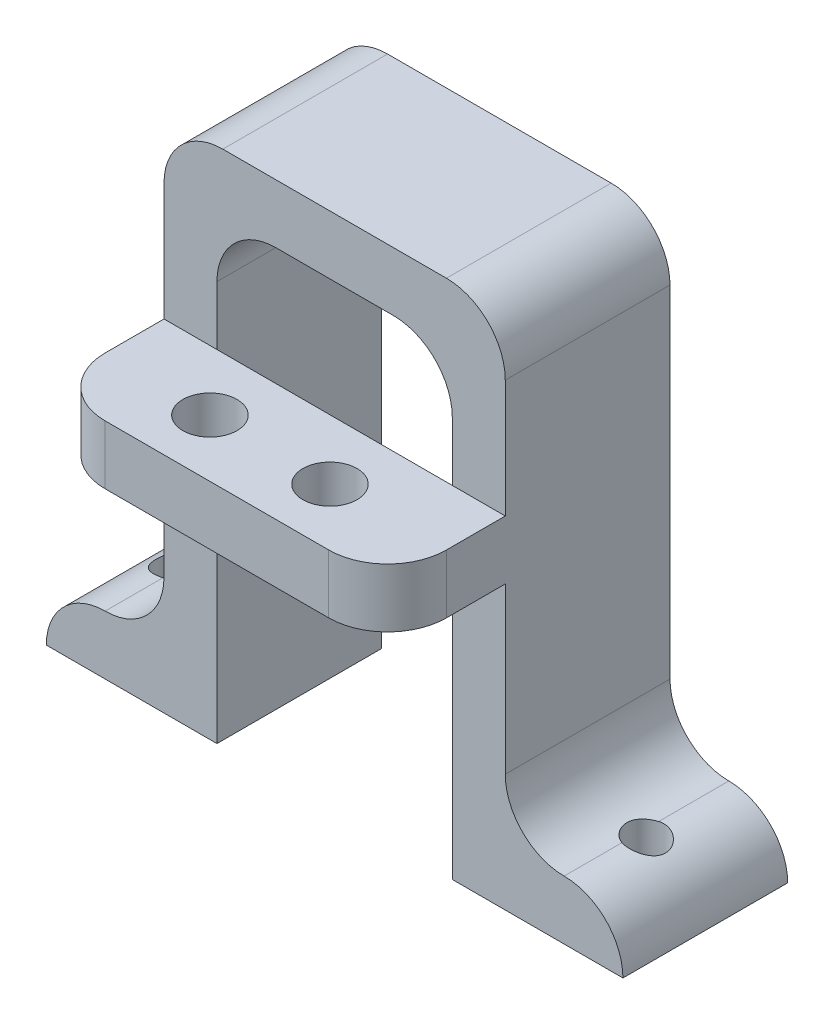
from build123d import *

# Parameters (mm, degrees)
BOSS_EXTRUDE1_DEPTH     = 14
FILLET1_R               = 5
FILLET2_R               = 5
CUT_EXTRUDE3_DEPTH      = 10
CUT_EXTRUDE3_DEPTH_BACK = 10
SKETCH2_R               = 1.636049027
SKETCH4_W               = 29
SKETCH4_H               = 5
BOSS_EXTRUDE2_DEPTH     = 10
SKETCH5_R               = 2.3
CUT_EXTRUDE4_DEPTH      = 30
FILLET3_R               = 5


with BuildPart() as part:
    # Sketch1 → Boss-Extrude1 (new body)
    with BuildSketch(Plane.XY):
        Polygon((-24.5, 0), (-24.5, 5), (-14.5, 5), (-14.5, 44), (14.5, 44), (14.5, 5), (24.5, 5), (24.5, 0), (10, 0), (10, 39), (-10, 39), (-10, 0), align=None)
    extrude(amount=BOSS_EXTRUDE1_DEPTH)

    # Fillet1
    fillet1_edges = [part.edges().sort_by_distance(p)[0] for p in [
        (-14.5, 44, 7),
        (14.5, 44, 7),
        (24.5, 5, 7),
        (-24.5, 5, 7),
        (14.5, 5, 7),
        (-14.5, 5, 7),
    ]]
    fillet(fillet1_edges, radius=FILLET1_R - 0.0001)  # a hair under: the kernel refuses the full size

    # Fillet2
    fillet2_edges = [part.edges().sort_by_distance(p)[0] for p in [
        (10, 39, 7),
        (-10, 39, 7),
    ]]
    fillet(fillet2_edges, radius=FILLET2_R)

    # Sketch2 → Cut-Extrude3 (cut, two sides: drawn at the far end of the back side and taken through both)
    with BuildSketch(Plane(origin=(0, 0, 0), x_dir=(1, 0, 0), z_dir=(0, 1, 0)).offset(-CUT_EXTRUDE3_DEPTH_BACK)):
        with Locations(Location((-20, -7.523321805, 0), (0, 0, 72.20487372))):
            Circle(SKETCH2_R)
        with Locations(Location((20, -7.523321805, 0), (0, 0, 107.795126278))):
            Circle(SKETCH2_R)
    extrude(amount=CUT_EXTRUDE3_DEPTH + CUT_EXTRUDE3_DEPTH_BACK, mode=Mode.SUBTRACT)

    # Sketch4 → Boss-Extrude2 (add)
    with BuildSketch(Plane.XY.offset(14)):
        with Locations((0, 26.5)):
            Rectangle(SKETCH4_W, SKETCH4_H)
    extrude(amount=BOSS_EXTRUDE2_DEPTH)

    # Sketch5 → Cut-Extrude4 (cut)
    with BuildSketch(Plane(origin=(0, 44, 0), x_dir=(1, 0, 0), z_dir=(0, 1, 0))):
        with Locations(Location((-5.477408827, -19.118067384, 0), (0, 0, 270))):
            Circle(SKETCH5_R)
        with Locations(Location((4.70575, -19.10149527, 0), (0, 0, 270))):
            Circle(SKETCH5_R)
    extrude(amount=-CUT_EXTRUDE4_DEPTH, mode=Mode.SUBTRACT)

    # Fillet3
    fillet3_edges = [part.edges().sort_by_distance(p)[0] for p in [
        (-14.5, 26.5, 24),
        (14.5, 26.5, 24),
    ]]
    fillet(fillet3_edges, radius=FILLET3_R)


solid = part.part
